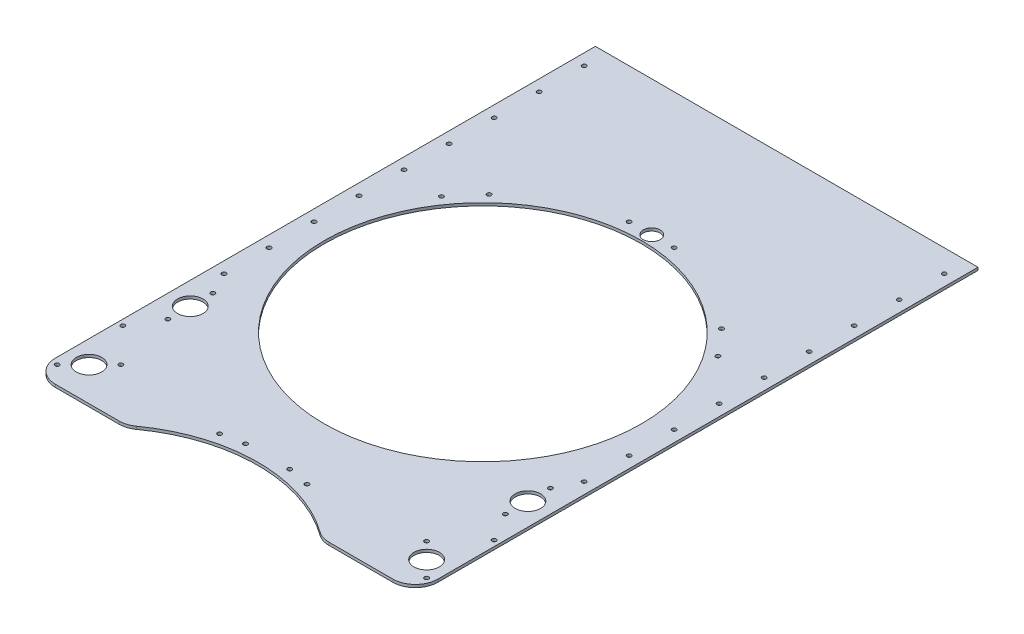
from build123d import *

# Parameters (mm, degrees)
SKETCH1_W           = 431.8
SKETCH1_H           = 685.8
BOSS_EXTRUDE1_DEPTH = 3.175
SKETCH2_R           = 14.3129
SKETCH2_R_2         = 2.38125
CUT_EXTRUDE1_DEPTH  = 406.22006444
SKETCH6_R           = 179.07
CUT_EXTRUDE4_DEPTH  = 406.22006444
SKETCH8_R           = 9.525
SKETCH8_R_2         = 2.38125
CUT_EXTRUDE6_DEPTH  = 406.22006444
FILLET2_R           = 25.4
SKETCH11_R          = 2.38125
CUT_EXTRUDE9_DEPTH  = 406.22006444
SKETCH13_R          = 2.38125
SKETCH13_R_2        = 2.466421692
SKETCH13_R_3        = 2.307769972
CUT_EXTRUDE10_DEPTH = 406.22006444
SKETCH14_R          = 2.38125
CUT_EXTRUDE11_DEPTH = 406.22006444
SKETCH16_W          = 431.8
SKETCH16_H          = 50.8
CUT_EXTRUDE13_DEPTH = 406.22006444
SKETCH17_R          = 177.8
SKETCH17_R_2        = 2.38125
CUT_EXTRUDE14_DEPTH = 406.22006444
FILLET3_R           = 25.4


with BuildPart() as part:
    # Sketch1 → Boss-Extrude1 (new body)
    with BuildSketch(Plane(origin=(0, 0, 0), x_dir=(1, 0, 0), z_dir=(0, 1, 0))):
        Rectangle(SKETCH1_W, SKETCH1_H)
    extrude(amount=BOSS_EXTRUDE1_DEPTH)

    # Sketch2 → Cut-Extrude1 (cut, through all)
    with BuildSketch(Plane(origin=(0, 3.175, 0), x_dir=(1, 0, 0), z_dir=(0, 1, 0))):
        with Locations((-190.5, -304.8)):
            Circle(SKETCH2_R)
        with Locations((-190.5, -190.5)):
            Circle(SKETCH2_R)
        with Locations((190.5, -190.5)):
            Circle(SKETCH2_R)
        with Locations((190.5, -215.9)):
            Circle(SKETCH2_R_2)
        with Locations((190.5, -165.1)):
            Circle(SKETCH2_R_2)
        with Locations((-190.5, -215.9)):
            Circle(SKETCH2_R_2)
        with Locations((-190.5, -165.1)):
            Circle(SKETCH2_R_2)
        with Locations((-208.460512242, -322.760512242)):
            Circle(SKETCH2_R_2)
        with Locations((-172.539487758, -286.839487758)):
            Circle(SKETCH2_R_2)
        with Locations((172.539487758, -286.839487758)):
            Circle(SKETCH2_R_2)
        with Locations((208.460512242, -322.760512242)):
            Circle(SKETCH2_R_2)
        with Locations((190.5, -304.8)):
            Circle(SKETCH2_R)
    extrude(amount=-CUT_EXTRUDE1_DEPTH, mode=Mode.SUBTRACT)

    # Sketch6 → Cut-Extrude4 (cut, through all)
    with BuildSketch(Plane(origin=(0, 3.175, 0), x_dir=(1, 0, 0), z_dir=(0, 1, 0))):
        with Locations((0, -50.8)):
            Circle(SKETCH6_R)
    extrude(amount=-CUT_EXTRUDE4_DEPTH, mode=Mode.SUBTRACT)

    # Sketch8 → Cut-Extrude6 (cut, through all)
    with BuildSketch(Plane(origin=(0, 3.175, 0), x_dir=(1, 0, 0), z_dir=(0, 1, 0))):
        with Locations((0, 139.7)):
            Circle(SKETCH8_R)
        with Locations((25.4, 139.7)):
            Circle(SKETCH8_R_2)
        with Locations((-25.4, 139.7)):
            Circle(SKETCH8_R_2)
    extrude(amount=-CUT_EXTRUDE6_DEPTH, mode=Mode.SUBTRACT)

    # Fillet2
    fillet2_edges = [part.edges().sort_by_distance(p)[0] for p in [
        (215.9, 1.5875, 342.9),
        (-215.9, 1.5875, 342.9),
    ]]
    fillet(fillet2_edges, radius=FILLET2_R)

    # Sketch11 → Cut-Extrude9 (cut, through all)
    with BuildSketch(Plane(origin=(0, 3.175, 0), x_dir=(1, 0, 0), z_dir=(0, 1, 0))):
        with Locations((156.048464437, 58.466311125)):
            Circle(SKETCH11_R)
        with Locations((131.183773775, 87.334237241)):
            Circle(SKETCH11_R)
        with Locations((-131.183773775, 87.334237241)):
            Circle(SKETCH11_R)
        with Locations((-156.048464437, 58.466311125)):
            Circle(SKETCH11_R)
    extrude(amount=-CUT_EXTRUDE9_DEPTH, mode=Mode.SUBTRACT)

    # Sketch13 → Cut-Extrude10 (cut, through all)
    with BuildSketch(Plane(origin=(0, 3.175, 0), x_dir=(1, 0, 0), z_dir=(0, 1, 0))):
        with Locations((-203.2, 317.5)):
            Circle(SKETCH13_R)
        with Locations((-203.2, 266.7)):
            Circle(SKETCH13_R)
        with Locations((-203.2, 215.9)):
            Circle(SKETCH13_R)
        with Locations((-203.2, 165.1)):
            Circle(SKETCH13_R)
        with Locations((-203.2, 114.3)):
            Circle(SKETCH13_R)
        with Locations((-203.2, 63.5)):
            Circle(SKETCH13_R)
        with Locations((-203.2, 12.7)):
            Circle(SKETCH13_R)
        with Locations((-203.2, -38.1)):
            Circle(SKETCH13_R)
        with Locations((-203.2, -88.9)):
            Circle(SKETCH13_R)
        with Locations((-203.2, -139.7)):
            Circle(SKETCH13_R)
        with Locations((203.2, -139.7)):
            Circle(SKETCH13_R)
        with Locations((203.2, 12.7)):
            Circle(SKETCH13_R)
        with Locations((203.2, 63.5)):
            Circle(SKETCH13_R)
        with Locations((203.2, 114.3)):
            Circle(SKETCH13_R)
        with Locations((203.2, 165.1)):
            Circle(SKETCH13_R)
        with Locations((203.2, 266.7)):
            Circle(SKETCH13_R)
        with Locations((203.2, 317.5)):
            Circle(SKETCH13_R)
        with Locations((-25.4, -330.2)):
            Circle(SKETCH13_R_2)
        with Locations((-50.8, -330.2)):
            Circle(SKETCH13_R_3)
        with Locations((50.8, -330.2)):
            Circle(SKETCH13_R_3)
        with Locations((25.4, -330.2)):
            Circle(SKETCH13_R_2)
        with Locations((203.2, -88.9)):
            Circle(SKETCH13_R)
        with Locations((203.2, -38.1)):
            Circle(SKETCH13_R)
        with Locations((203.2, 215.9)):
            Circle(SKETCH13_R)
    extrude(amount=-CUT_EXTRUDE10_DEPTH, mode=Mode.SUBTRACT)

    # Sketch14 → Cut-Extrude11 (cut, through all)
    with BuildSketch(Plane(origin=(0, 3.175, 0), x_dir=(1, 0, 0), z_dir=(0, 1, 0))):
        with Locations((209.55, -247.65)):
            Circle(SKETCH14_R)
        with Locations((-209.55, -247.65)):
            Circle(SKETCH14_R)
    extrude(amount=-CUT_EXTRUDE11_DEPTH, mode=Mode.SUBTRACT)

    # Sketch16 → Cut-Extrude13 (cut, through all)
    with BuildSketch(Plane(origin=(0, 3.175, 0), x_dir=(1, 0, 0), z_dir=(0, 1, 0))):
        with Locations((0, 317.5)):
            Rectangle(SKETCH16_W, SKETCH16_H)
    extrude(amount=-CUT_EXTRUDE13_DEPTH, mode=Mode.SUBTRACT)

    # Sketch17 → Cut-Extrude14 (cut, through all)
    with BuildSketch(Plane(origin=(0, 0, 0), x_dir=(-1, 0, 0), z_dir=(0, -1, 0))):
        with Locations((0, -482.6)):
            Circle(SKETCH17_R)
        with Locations((24.865239618, -293.729753908)):
            Circle(SKETCH17_R_2)
        with Locations((49.305028092, -298.591130092)):
            Circle(SKETCH17_R_2)
        with Locations((-24.865239618, -293.729753908)):
            Circle(SKETCH17_R_2)
        with Locations((-49.305028092, -298.591130092)):
            Circle(SKETCH17_R_2)
    extrude(amount=-CUT_EXTRUDE14_DEPTH, mode=Mode.SUBTRACT)

    # Fillet3
    fillet3_edges = [part.edges().sort_by_distance(p)[0] for p in [
        (109.985226281, 1.5875, 342.9),
        (-109.985226281, 1.5875, 342.9),
    ]]
    fillet(fillet3_edges, radius=FILLET3_R)


solid = part.part
